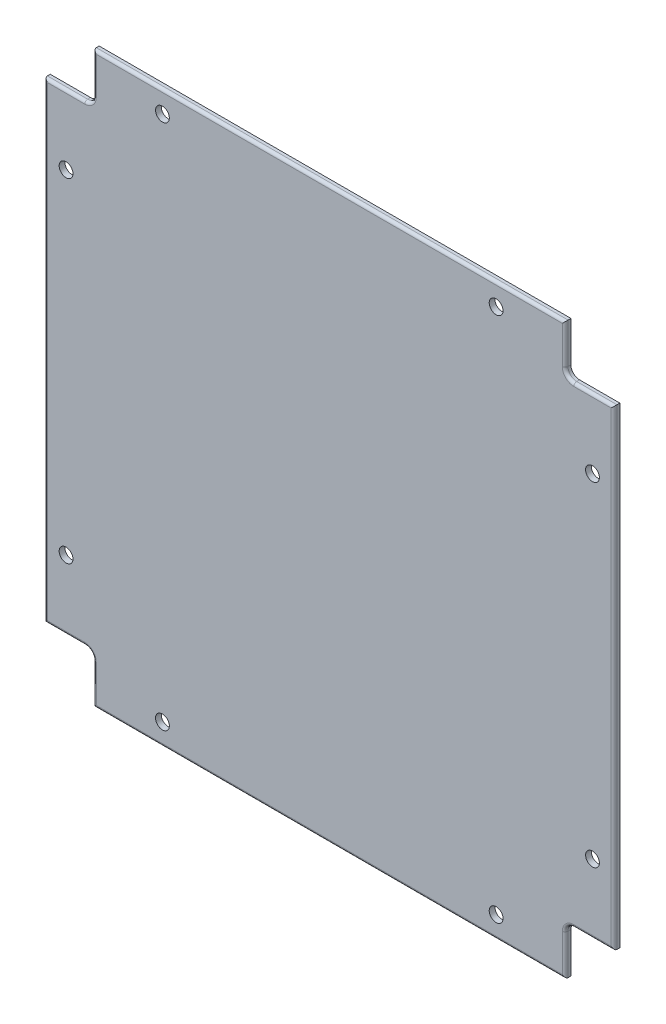
from build123d import *

# Parameters (mm, degrees)
SKETCH1_W           = 99
SKETCH1_H           = 99
BOSS_EXTRUDE1_DEPTH = 0.5
CUT_EXTRUDE1_DEPTH  = 71.010713466
M2_HOLE1_B_D        = 2.4
M2_HOLE1_B_DEPTH    = 3
M2_HOLE1_B_TIP      = 0.721032743
FILLET1_R           = 0.5


with BuildPart() as part:
    # Sketch1 → Boss-Extrude1 (new, symmetric)
    with BuildSketch(Plane.XY):
        Rectangle(SKETCH1_W, SKETCH1_H)
    extrude(amount=BOSS_EXTRUDE1_DEPTH, both=True)

    # Sketch2 → Cut-Extrude1 (cut, through all)
    with BuildSketch(Plane.XY.offset(0.5)):
        with BuildLine():
            Line((-49.5, 49.5), (-41, 49.5))
            Line((-41, 49.5), (-41, 42.5))
            ThreePointArc((-41, 42.5), (-41.439339828, 41.439339828), (-42.5, 41))
            Line((-42.5, 41), (-49.5, 41))
            Line((-49.5, 41), (-49.5, 49.5))
        make_face()
        with BuildLine():
            Line((49.5, 49.5), (41, 49.5))
            Line((41, 49.5), (41, 42.5))
            ThreePointArc((41, 42.5), (41.439339828, 41.439339828), (42.5, 41))
            Line((42.5, 41), (49.5, 41))
            Line((49.5, 41), (49.5, 49.5))
        make_face()
        with BuildLine():
            Line((-49.5, -49.5), (-41, -49.5))
            Line((-41, -49.5), (-41, -42.5))
            ThreePointArc((-41, -42.5), (-41.439339828, -41.439339828), (-42.5, -41))
            Line((-42.5, -41), (-49.5, -41))
            Line((-49.5, -41), (-49.5, -49.5))
        make_face()
        with BuildLine():
            Line((49.5, -49.5), (41, -49.5))
            Line((41, -49.5), (41, -42.5))
            ThreePointArc((41, -42.5), (41.439339828, -41.439339828), (42.5, -41))
            Line((42.5, -41), (49.5, -41))
            Line((49.5, -41), (49.5, -49.5))
        make_face()
    extrude(amount=-CUT_EXTRUDE1_DEPTH, mode=Mode.SUBTRACT)

    # M2 Hole1 - B
    with Locations(Plane.XY.offset(0.5)):
        with Locations((-45.75, 29), (-29, 45.75), (29, 45.75), (45.75, 29), (45.75, -29), (29, -45.75), (-29, -45.75), (-45.75, -29)):
            Hole(M2_HOLE1_B_D / 2, depth=M2_HOLE1_B_DEPTH)
            with Locations((0, 0, -(M2_HOLE1_B_DEPTH + M2_HOLE1_B_TIP / 2))):  # 118° drill point
                Cone(0, M2_HOLE1_B_D / 2, M2_HOLE1_B_TIP, mode=Mode.SUBTRACT)

    # Fillet1
    fillet1_edges = [part.edges().sort_by_distance(p)[0] for p in [
        (41, 46, 0.5),
        (46, 41, 0.5),
        (49.5, 0, 0.5),
        (46, -41, 0.5),
        (41, -46, 0.5),
        (0, -49.5, 0.5),
        (-41, -46, 0.5),
        (-46, -41, 0.5),
        (-49.5, 0, 0.5),
        (-46, 41, 0.5),
        (-41, 46, 0.5),
        (0, 49.5, 0.5),
        (-41.439339828, 41.439339828, 0.5),
        (41.439339828, 41.439339828, 0.5),
        (41.439339828, -41.439339828, 0.5),
        (-41.439339828, -41.439339828, 0.5),
    ]]
    fillet(fillet1_edges, radius=FILLET1_R)


solid = part.part
